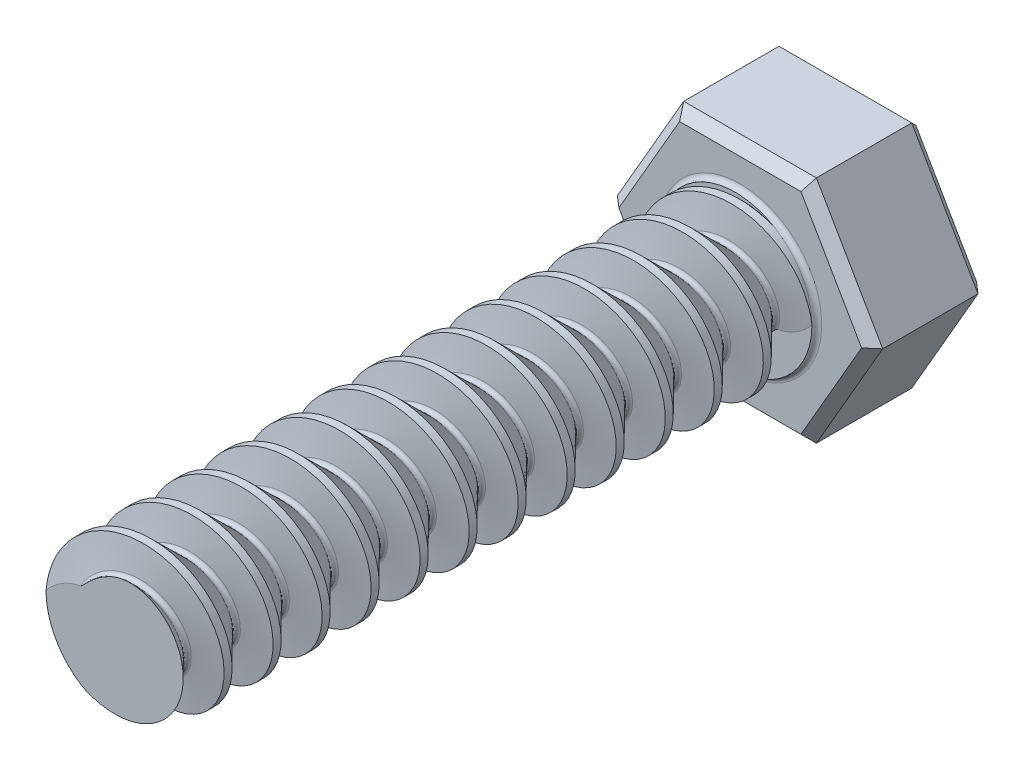
from build123d import *

# Parameters (mm, degrees)
SKETCH1_R           = 7.9375
BOSS_EXTRUDE1_DEPTH = 63.5
CUT_SWEEP1_PITCH    = 5.08
BOSS_EXTRUDE3_START = 0.508
SKETCH5_R           = 7.9375
BOSS_EXTRUDE3_DEPTH = 0.508
BOSS_EXTRUDE4_DEPTH = 11.90625
FILLET1_R           = 0.508
CHAMFER1_SIZE       = 1.016


with BuildPart() as part:
    # Sketch1 → Boss-Extrude1 (new body)
    with BuildSketch(Plane.XY):
        Circle(SKETCH1_R)
    extrude(amount=BOSS_EXTRUDE1_DEPTH)

    # Cut-Sweep1: arcs per turn and ends read off the stored shape
    # Cut-Sweep1: the profile of Sketch3 profile screwed along a right-hand helix through 17 turns, 12 arcs to a turn; built about Z, then put on its axis
    cut_sweep1_z = Axis((0, 0, 0), (0, 0, 1))
    cut_sweep1_corners = [(7.9378, 0, -5.080036835), (4.889502605, 0, -4.705752978), (4.590755145, 0, -4.463832055), (4.677229963, 0, -4.089268464), (7.9378, 0, -0.828698427)]
    with BuildLine(mode=Mode.PRIVATE) as cut_sweep1_profile:
        Line(cut_sweep1_corners[0], cut_sweep1_corners[1])
        Line(cut_sweep1_corners[3], cut_sweep1_corners[4])
        Line(cut_sweep1_corners[4], cut_sweep1_corners[0])
        ThreePointArc((4.889502605, 0, -4.705752978), (4.705444021, 0, -4.627624744), (4.590755145, 0, -4.463832055))
        ThreePointArc((4.590755145, 0, -4.463832055), (4.580290363, 0, -4.264152132), (4.677229963, 0, -4.089268464))
    cut_sweep1_cap = Face(cut_sweep1_profile.wire())
    cut_sweep1_arcs = [((4.889502605, 0, -4.705752978), (4.66454439, 0, -4.678131583), (4.590755145, 0, -4.463832055), (1, 0.8480480961564245, 1)), ((4.590755145, 0, -4.463832055), (4.5169659, 0, -4.249532527), (4.677229963, 0, -4.089268464), (1, 0.8480480961564245, 1))]  # start, shoulder, end, weights
    cut_sweep1_turn_angles = [0, 15, 30, 45, 60, 75, 90, 105, 120, 135, 150, 165, 180, 195, 210, 225, 240, 255, 270, 285, 300, 315, 330, 345, 360]
    cut_sweep1_turn_weights = [1, 0.9659258262890683, 1, 0.9659258262890683, 1, 0.9659258262890683, 1, 0.9659258262890683, 1, 0.9659258262890683, 1, 0.9659258262890683, 1, 0.9659258262890683, 1, 0.9659258262890683, 1, 0.9659258262890683, 1, 0.9659258262890683, 1, 0.9659258262890683, 1, 0.9659258262890683, 1]
    cut_sweep1_turn_rails = [Edge.make_bspline([Vector(p[0], p[1], 0).rotate(cut_sweep1_z, cut_sweep1_turn_angles[k]) / cut_sweep1_turn_weights[k] + Vector(0, 0, p[2] + CUT_SWEEP1_PITCH * cut_sweep1_turn_angles[k] / 360) for k in range(25)], [0, 0, 0, 1, 1, 2, 2, 3, 3, 4, 4, 5, 5, 6, 6, 7, 7, 8, 8, 9, 9, 10, 10, 11, 11, 12, 12, 12], 2, cut_sweep1_turn_weights) for p in cut_sweep1_corners]
    cut_sweep1_turn_sides = [*[Face.make_surface_from_curves(cut_sweep1_turn_rails[p[0]], cut_sweep1_turn_rails[p[1]]) for p in [(0, 1), (3, 4), (4, 0)]], *[Face.make_bezier_surface([[Vector(p[j][0], p[j][1], 0).rotate(cut_sweep1_z, cut_sweep1_turn_angles[2 * i + k]) / cut_sweep1_turn_weights[2 * i + k] + Vector(0, 0, p[j][2] + CUT_SWEEP1_PITCH * cut_sweep1_turn_angles[2 * i + k] / 360) for k in range(3)] for j in range(3)], [[p[3][j] * cut_sweep1_turn_weights[2 * i + k] for k in range(3)] for j in range(3)]) for p in cut_sweep1_arcs for i in range(12)]]
    cut_sweep1 = Plane(origin=(0, 0, 0), x_dir=(1, 0, 0), z_dir=(0, 0, 1)) * Solid(Shell([*[p.moved(Location((0, 0, CUT_SWEEP1_PITCH * i))) for i in range(17) for p in cut_sweep1_turn_sides], cut_sweep1_cap, cut_sweep1_cap.rotate(cut_sweep1_z, 6120).moved(Location((0, 0, CUT_SWEEP1_PITCH * 6120 / 360)))]))
    add(cut_sweep1, mode=Mode.SUBTRACT)

    # Sketch5 → Boss-Extrude3 (add)
    with BuildSketch(Plane(origin=(0, 0, 0), x_dir=(-1, 0, 0), z_dir=(0, 0, -1)).offset(BOSS_EXTRUDE3_START)):
        Circle(SKETCH5_R)
    extrude(amount=-BOSS_EXTRUDE3_DEPTH)

    # Sketch6 → Boss-Extrude4 (add)
    with BuildSketch(Plane(origin=(0, 0, -0.508), x_dir=(-1, 0, 0), z_dir=(0, 0, -1))):
        Polygon((13.748153285, 0), (6.874076643, 11.90625), (-6.874076643, 11.90625), (-13.748153285, 0), (-6.874076643, -11.90625), (6.874076643, -11.90625), align=None)
    extrude(amount=BOSS_EXTRUDE4_DEPTH)

    # Fillet1
    fillet1_edges = [part.edges().sort_by_distance(p)[0] for p in [
        (7.9375, 0, -0.508),
    ]]
    fillet(fillet1_edges, radius=FILLET1_R - 0.0001)  # a hair under: the kernel refuses the full size

    # Chamfer1
    chamfer1_edges = [part.edges().sort_by_distance(p)[0] for p in [
        (-10.311114964, -5.953125, -0.508),
        (-10.311114964, 5.953125, -0.508),
        (0, 11.90625, -0.508),
        (10.311114964, 5.953125, -0.508),
        (10.311114964, -5.953125, -0.508),
        (0, -11.90625, -0.508),
        (-10.311114964, -5.953125, -12.41425),
        (-10.311114964, 5.953125, -12.41425),
        (0, 11.90625, -12.41425),
        (10.311114964, 5.953125, -12.41425),
        (10.311114964, -5.953125, -12.41425),
        (0, -11.90625, -12.41425),
    ]]
    chamfer(chamfer1_edges, length=CHAMFER1_SIZE)


solid = part.part
